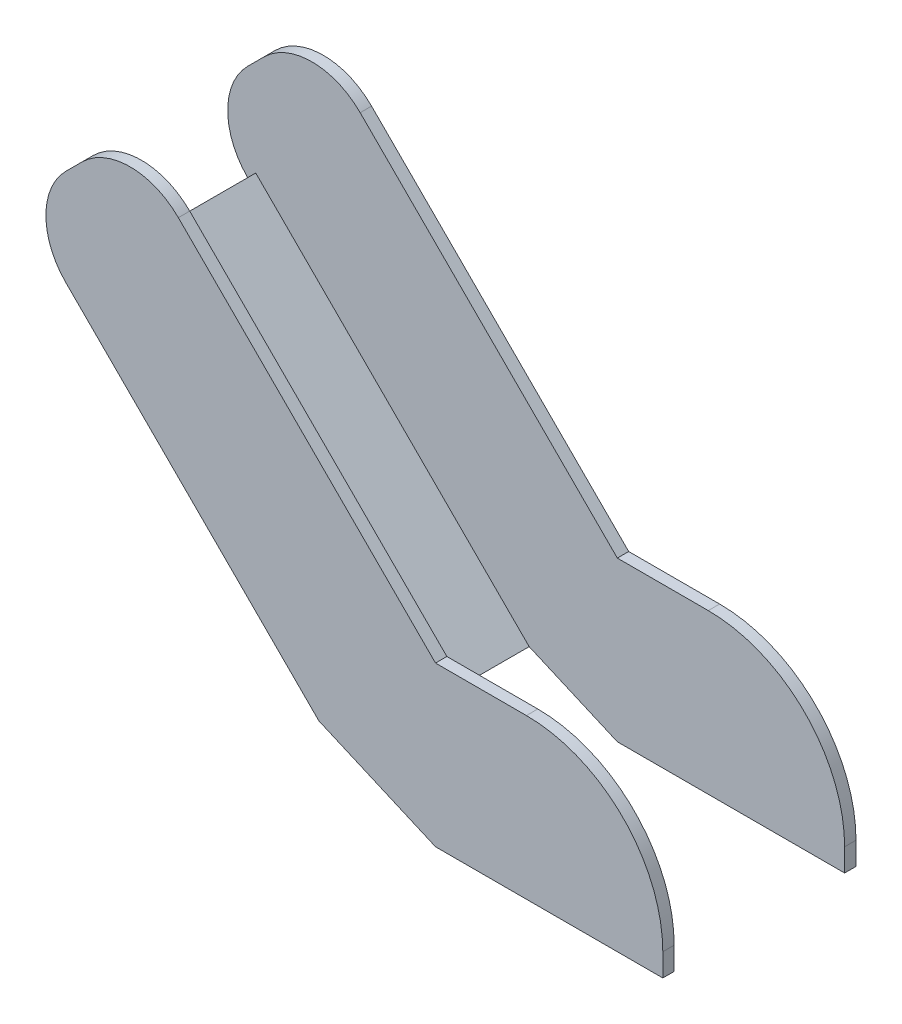
from build123d import *

# Parameters (mm, degrees)
BOSS_EXTRUDE1_DEPTH = 42.5
SHELL3_START        = -130.355339059
SHELL3_OUTLINE_W    = 56.855339059
SHELL3_OUTLINE_H    = 37.5
SHELL3_DEPTH        = 155.104076401
SHELL3_2_OUTLINE_W  = 4.144660941
SHELL3_2_OUTLINE_H  = 37.5
SHELL3_2_DEPTH      = 15


# Read off the part's stored shape, not the designer's step: Shell3
with BuildPart() as part:
    # Sketch1 → Boss-Extrude1 (new body)
    with BuildSketch(Plane.XY):
        with BuildLine():
            Line((-30, 0), (-50, 0))
            Line((-50, 0), (-106.568542495, 56.568542495))
            ThreePointArc((-106.568542495, 56.568542495), (-117.175144213, 60.961940777), (-127.781745931, 56.568542495))
            Line((-127.781745931, 56.568542495), (-131.317279836, 53.033008589))
            ThreePointArc((-131.317279836, 53.033008589), (-135.710678119, 42.426406871), (-131.317279836, 31.819805153))
            Line((-131.317279836, 31.819805153), (-75.648177206, -23.849297477))
            Line((-75.648177206, -23.849297477), (-50, -35))
            Line((-50, -35), (0, -35))
            Line((0, -35), (0, -30))
            ThreePointArc((0, -30), (-8.786796564, -8.786796564), (-30, 0))
        make_face()
    extrude(amount=BOSS_EXTRUDE1_DEPTH)

    # Shell3 outline → Shell3 (cut)
    with BuildSketch(Plane(origin=(0, 0, 0), x_dir=(0.7071067811865431, 0.707106781186552, 0), z_dir=(0.707106781186552, -0.707106781186543, 0)).offset(SHELL3_START)):
        with Locations((-39.42766953, 21.25)):
            Rectangle(SHELL3_OUTLINE_W, SHELL3_OUTLINE_H)
    extrude(amount=SHELL3_DEPTH, mode=Mode.SUBTRACT)

    # Shell3 2 outline → Shell3 2 (cut)
    with BuildSketch(Plane(origin=(0, 0, 0), x_dir=(0.7071067811865431, 0.707106781186552, 0), z_dir=(0.707106781186552, -0.707106781186543, 0)).offset(SHELL3_START)):
        with Locations((-69.92766953, 21.25)):
            Rectangle(SHELL3_2_OUTLINE_W, SHELL3_2_OUTLINE_H)
    extrude(amount=SHELL3_2_DEPTH, mode=Mode.SUBTRACT)


solid = part.part
